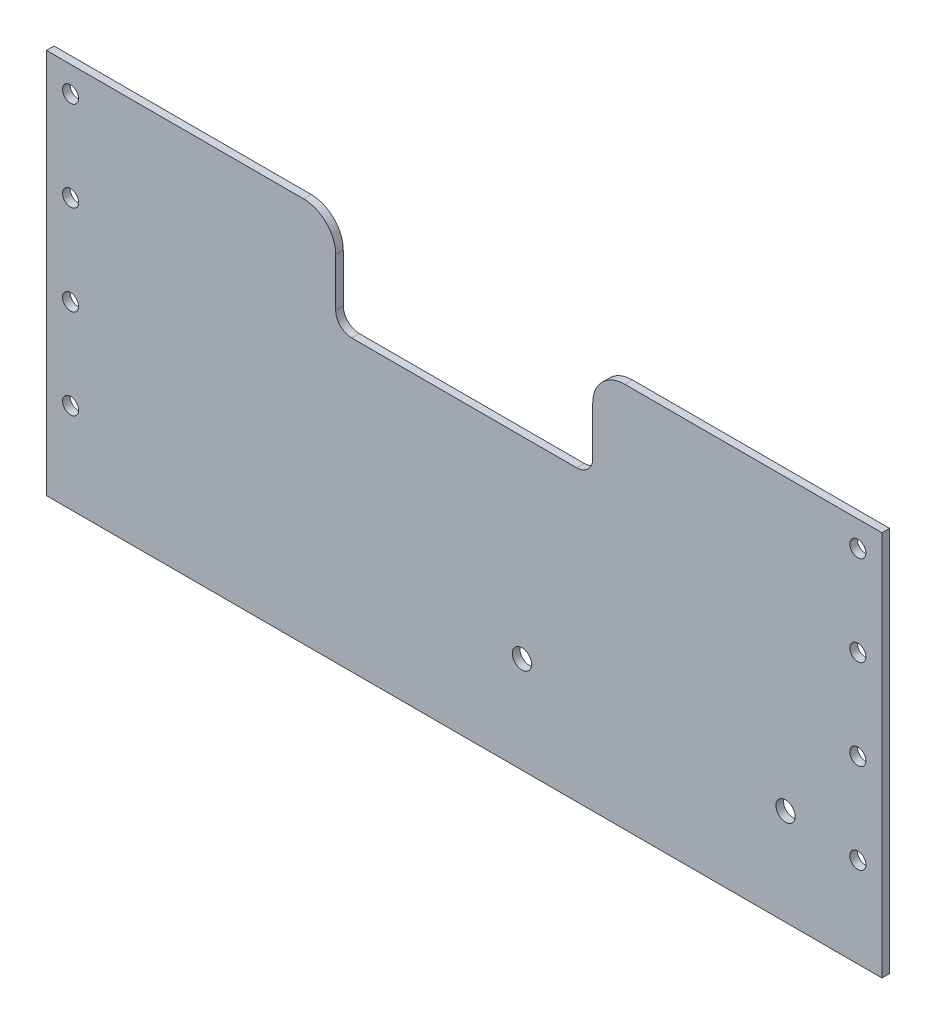
from build123d import *

# Parameters (mm, degrees)
SKETCH5_R           = 1.5875
SKETCH5_R_2         = 1.906243542
BOSS_EXTRUDE2_DEPTH = 1.5


with BuildPart() as part:
    # Sketch5 → Boss-Extrude2 (new body)
    with BuildSketch(Plane.XY):
        with BuildLine():
            Line((-82.55, 17.863023715), (-82.55, -58.336976285))
            Line((-82.55, -58.336976285), (82.55, -58.336976285))
            Line((82.55, -58.336976285), (82.55, 17.863023715))
            Line((82.55, 17.863023715), (31.75, 17.863023715))
            ThreePointArc((31.75, 17.863023715), (27.259871939, 16.003151775), (25.4, 11.513023715))
            Line((25.4, 11.513023715), (25.4, 1.988023715))
            ThreePointArc((25.4, 1.988023715), (24.47006403, -0.257040316), (22.225, -1.186976285))
            Line((22.225, -1.186976285), (-22.225, -1.186976285))
            ThreePointArc((-22.225, -1.186976285), (-24.47006403, -0.257040316), (-25.4, 1.988023715))
            Line((-25.4, 1.988023715), (-25.4, 11.513023715))
            ThreePointArc((-25.4, 11.513023715), (-27.259871939, 16.003151775), (-31.75, 17.863023715))
            Line((-31.75, 17.863023715), (-82.55, 17.863023715))
        make_face()
        with Locations((-77.7875, -40.556976285)):
            Circle(SKETCH5_R, mode=Mode.SUBTRACT)
        with Locations((-77.7875, -22.776976285)):
            Circle(SKETCH5_R, mode=Mode.SUBTRACT)
        with Locations((-77.7875, -4.996976285)):
            Circle(SKETCH5_R, mode=Mode.SUBTRACT)
        with Locations((-77.7875, 12.783023715)):
            Circle(SKETCH5_R, mode=Mode.SUBTRACT)
        with Locations((11.416585625, -39.286976285)):
            Circle(SKETCH5_R_2, mode=Mode.SUBTRACT)
        with Locations((63.5, -39.286976285)):
            Circle(SKETCH5_R_2, mode=Mode.SUBTRACT)
        with Locations((77.7875, 12.783023715)):
            Circle(SKETCH5_R, mode=Mode.SUBTRACT)
        with Locations((77.7875, -4.996976285)):
            Circle(SKETCH5_R, mode=Mode.SUBTRACT)
        with Locations((77.7875, -22.776976285)):
            Circle(SKETCH5_R, mode=Mode.SUBTRACT)
        with Locations((77.7875, -40.556976285)):
            Circle(SKETCH5_R, mode=Mode.SUBTRACT)
    extrude(amount=BOSS_EXTRUDE2_DEPTH)


solid = part.part
